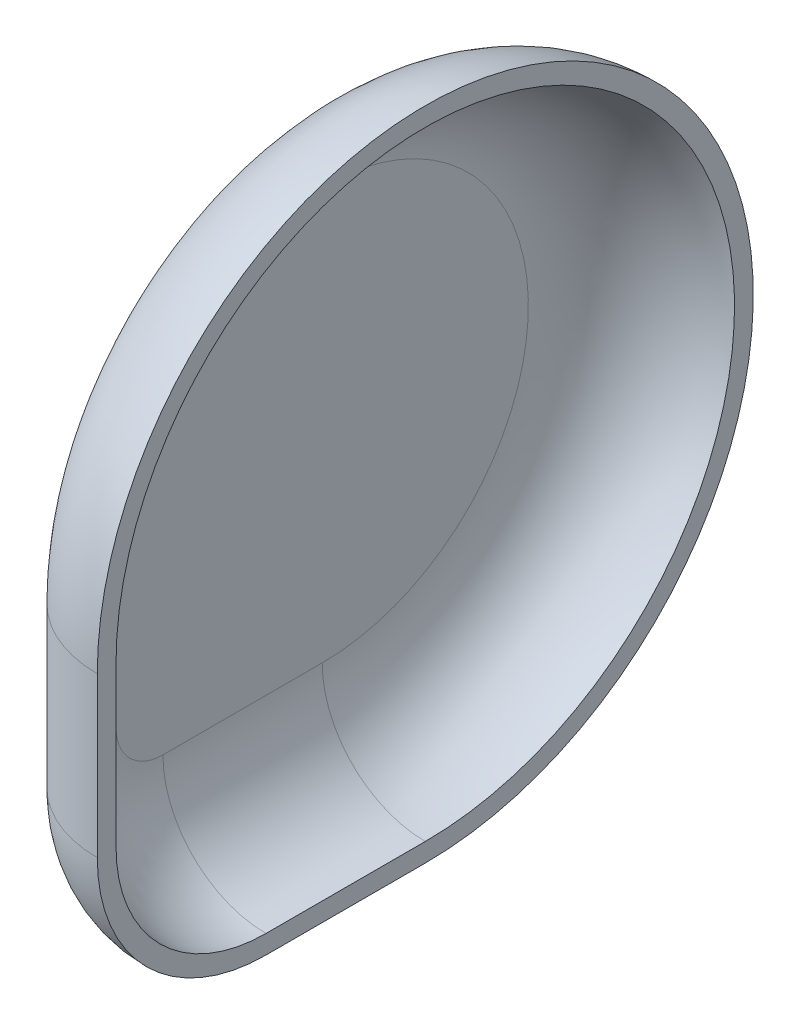
from build123d import *

# Parameters (mm, degrees)
SALIENTE_EXTRUIR1_DEPTH = 13
REDONDEO1_R             = 13
VACIADO1_START          = -17
VACIADO1_3_DEPTH        = 17
VACIADO1_4_DEPTH        = 17


with BuildPart() as part:
    # Croquis1 → Saliente-Extruir1 (new body)
    with BuildSketch(Plane(origin=(0, 0, 0), x_dir=(0, 0, -1), z_dir=(1, 0, 0))):
        with BuildLine():
            Line((0, -35), (-17, -35))
            ThreePointArc((-17, -35), (-29.727922061, -29.727922061), (-35, -17))
            Line((-35, -17), (-35, 0))
            ThreePointArc((-35, 0), (24.748737342, 24.748737342), (0, -35))
        make_face()
    extrude(amount=SALIENTE_EXTRUIR1_DEPTH)

    # Redondeo1
    redondeo1_edges = [part.edges().sort_by_distance(p)[0] for p in [
        (0, -35, 8.5),
        (0, -29.727922061, 29.727922061),
        (0, -8.5, 35),
        (0, 24.748737342, -24.748737342),
    ]]
    fillet(redondeo1_edges, radius=REDONDEO1_R - 0.0001)  # a hair under: the kernel refuses the full size

    # Vaciado1: read off the stored shape, not the designer's step
    # Vaciado1 outline → Vaciado1 (revolve, cut)
    with BuildSketch(Plane(origin=(0, -17, 17), x_dir=(0, 1, 0), z_dir=(0, 0, -1))):
        with BuildLine():
            Line((0, 13), (0, 2))
            Line((0, 2), (5, 2))
            ThreePointArc((5, 2), (12.778174593, 5.221825407), (16, 13))
            Line((16, 13), (0, 13))
        make_face()
    revolve(axis=Axis((0, -17, 17), (1, 0, 0)), mode=Mode.SUBTRACT)

    # Vaciado1 2 outline → Vaciado1 2 (revolve, cut)
    with BuildSketch(Plane.YX):
        with BuildLine():
            Line((33, 13), (0, 13))
            Line((0, 13), (0, 2))
            Line((0, 2), (22, 2))
            ThreePointArc((22, 2), (29.778174593, 5.221825407), (33, 13))
        make_face()
    revolve(axis=Axis((0, 0, 0), (1, 0, 0)), mode=Mode.SUBTRACT)

    # Vaciado1 3 outline → Vaciado1 3 (cut)
    with BuildSketch(Plane(origin=(0, 0, 0), x_dir=(1, 0, 0), z_dir=(0, 1, 0)).offset(VACIADO1_START)):
        with BuildLine():
            ThreePointArc((2, -22), (5.221825407, -29.778174593), (13, -33))
            Line((13, -33), (13, -9))
            Line((13, -9), (2, -9))
            Line((2, -9), (2, -22))
        make_face()
    extrude(amount=VACIADO1_3_DEPTH, mode=Mode.SUBTRACT)

    # Vaciado1 4 outline → Vaciado1 4 (cut)
    with BuildSketch(Plane.XY):
        with BuildLine():
            ThreePointArc((2, -22), (5.221825407, -29.778174593), (13, -33))
            Line((13, -33), (13, 1))
            Line((13, 1), (2, 1))
            Line((2, 1), (2, -22))
        make_face()
    extrude(amount=VACIADO1_4_DEPTH, mode=Mode.SUBTRACT)


solid = part.part
